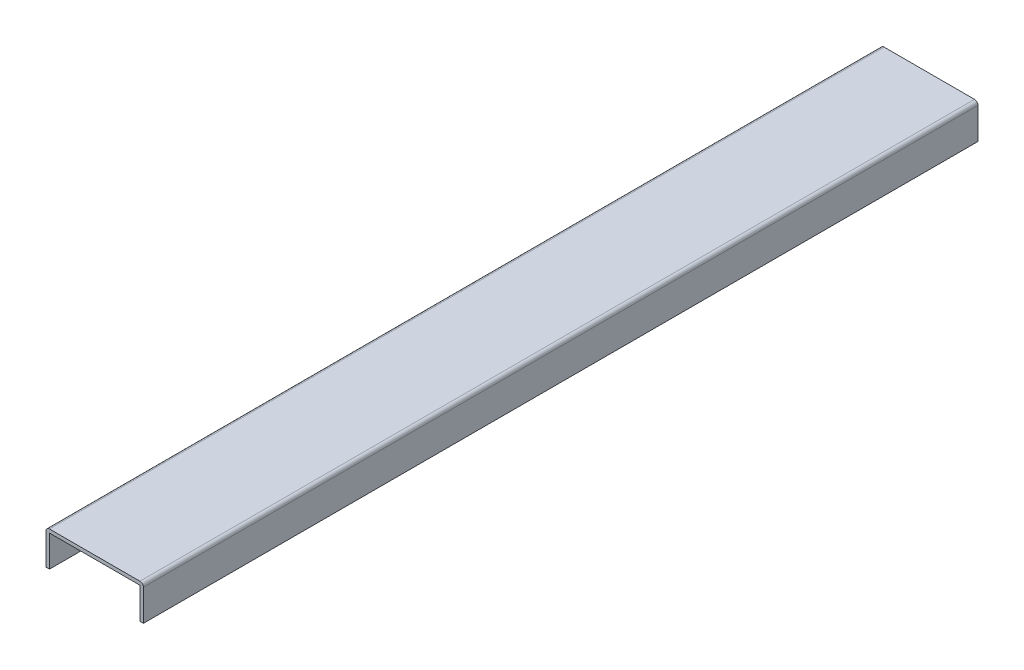
from build123d import *

# Parameters (mm, degrees)
ESBO_O1_W                = 140
ESBO_O1_H                = 50
RESSALTO_EXTRUS_O1_DEPTH = 1200
FILETE1_R                = 5
CASCA1_START             = -65
CASCA1_OUTLINE_W         = 45
CASCA1_OUTLINE_H         = 1200
CASCA1_DEPTH             = 130


# Read off the part's stored shape, not the designer's step: Casca1
with BuildPart() as part:
    # Esboço1 → Ressalto-extrusão1 (new body)
    with BuildSketch(Plane.XY):
        Rectangle(ESBO_O1_W, ESBO_O1_H)
    extrude(amount=RESSALTO_EXTRUS_O1_DEPTH)

    # Filete1
    filete1_edges = [part.edges().sort_by_distance(p)[0] for p in [
        (-70, 25, 600),
        (70, 25, 600),
    ]]
    fillet(filete1_edges, radius=FILETE1_R)

    # Casca1 outline → Casca1 (cut)
    with BuildSketch(Plane.YZ.offset(CASCA1_START)):
        with Locations((-2.5, 600)):
            Rectangle(CASCA1_OUTLINE_W, CASCA1_OUTLINE_H)
    extrude(amount=CASCA1_DEPTH, mode=Mode.SUBTRACT)


solid = part.part
